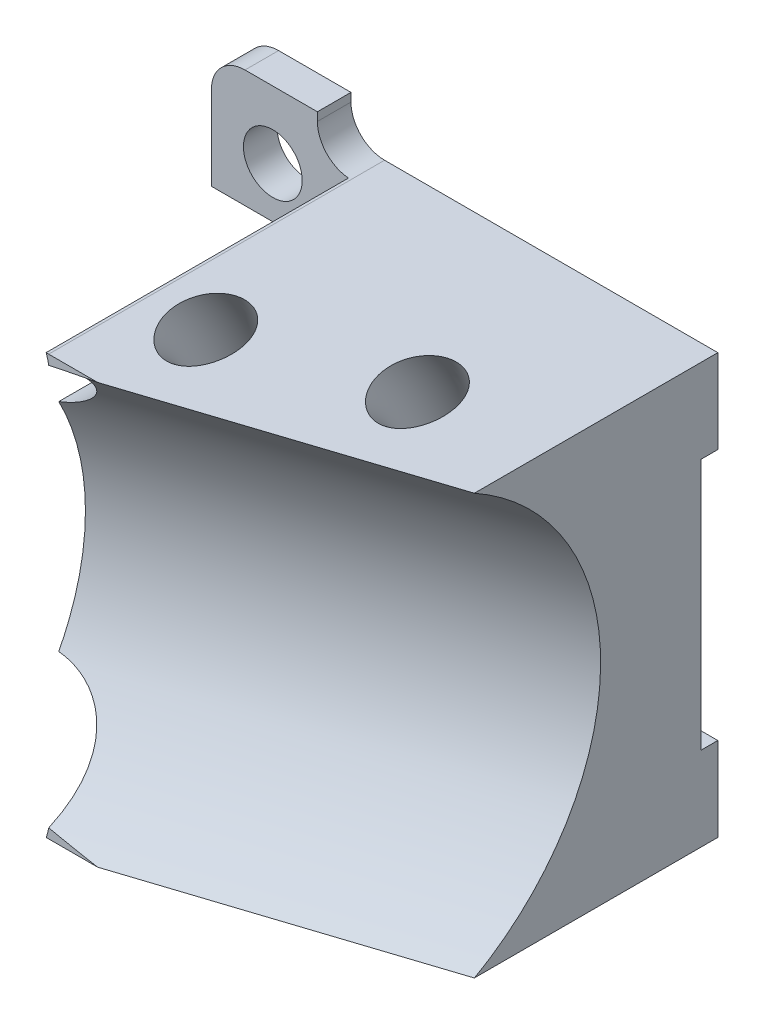
from build123d import *

# Parameters (mm, degrees)
SKETCH1_W               = 25
SKETCH1_H               = 25
BOSS_EXTRUDE1_DEPTH     = 20
SKETCH2_R               = 14.5
CUT_EXTRUDE1_DEPTH      = 36.825056471
SKETCH3_W               = 6.310364348
SKETCH3_H               = 30
BOSS_EXTRUDE2_DEPTH     = 2
SKETCH4_W               = 10
SKETCH4_H               = 16
CUT_EXTRUDE2_DEPTH      = 30.497198662
CUT_EXTRUDE3_DEPTH      = 29.179509025
CUT_EXTRUDE3_DEPTH_BACK = 29.179509025
SKETCH5_R               = 1.75
SKETCH7_R               = 4.75
CUT_EXTRUDE4_DEPTH      = 29.179509089
CUT_SWEEP1_PROFILE_R    = 2
LPATTERN1_COUNT         = 2
LPATTERN1_PITCH         = 10
FILLET1_START           = -1
FILLET1_DEPTH           = 21
FILLET1_2_DEPTH         = 2
FILLET1_START_2         = 1.80548
FILLET1_3_DEPTH         = 18.19452
SKETCH11_W              = 2
SKETCH11_H              = 15
CUT_EXTRUDE5_DEPTH      = 38.652546889


with BuildPart() as part:
    # Sketch1 → Boss-Extrude1 (new body)
    with BuildSketch(Plane.XY):
        Rectangle(SKETCH1_W, SKETCH1_H)
    extrude(amount=BOSS_EXTRUDE1_DEPTH)

    # Sketch2 → Cut-Extrude1 (cut, through all)
    with BuildSketch(Plane(origin=(11.306356215, 0, -3.673657827), x_dir=(0, 1, 0), z_dir=(0.9510565162951534, 0, -0.3090169943749482))):
        with Locations((0, 25)):
            Circle(SKETCH2_R)
    extrude(amount=-CUT_EXTRUDE1_DEPTH, mode=Mode.SUBTRACT)

    # Sketch3 → Boss-Extrude2 (add)
    with BuildSketch(Plane.XY):
        with Locations((-12.5, 0)):
            Rectangle(SKETCH3_W, SKETCH3_H)
    extrude(amount=BOSS_EXTRUDE2_DEPTH)

    # Sketch4 → Cut-Extrude2 (cut, through all)
    with BuildSketch(Plane.XY):
        with Locations((-15.655182174, 0)):
            Rectangle(SKETCH4_W, SKETCH4_H)
    extrude(amount=CUT_EXTRUDE2_DEPTH, mode=Mode.SUBTRACT)

    # Sketch5 → Cut-Extrude3 (cut, two sides: drawn at the far end of the back side and taken through both)
    with BuildSketch(Plane.XY.offset(2).offset(-CUT_EXTRUDE3_DEPTH_BACK)):
        with Locations((-12, 11)):
            Circle(SKETCH5_R)
        with Locations((-12, -11)):
            Circle(SKETCH5_R)
    extrude(amount=CUT_EXTRUDE3_DEPTH + CUT_EXTRUDE3_DEPTH_BACK, mode=Mode.SUBTRACT)

    # Sketch7 → Cut-Extrude4 (cut, through all)
    with BuildSketch(Plane.XY.offset(2)):
        with Locations((-12, 11)):
            Circle(SKETCH7_R)
        with Locations((-12, -11)):
            Circle(SKETCH7_R)
    extrude(amount=CUT_EXTRUDE4_DEPTH, mode=Mode.SUBTRACT)

    # Cut-Sweep1: sweep along a path in Sketch8
    with BuildLine(Plane(origin=(1.795791052, 0, -0.583487883), x_dir=(0, 1, 0), z_dir=(0.9510565162951534, 0, -0.3090169943749482))) as cut_sweep1_path:
        CenterArc((0, 25), 18, 0, 360)
    # Cut-Sweep1 profile (on start of the path) → Cut-Sweep1 (sweep, cut)
    with BuildSketch(Plane(origin=(9.521215911, 18, 23.192925024), x_dir=(0.9510565162951534, 0, -0.3090169943749482), z_dir=(0.3090169943749482, 0, 0.9510565162951534))):
        Circle(CUT_SWEEP1_PROFILE_R)
    cut_sweep1 = sweep(path=cut_sweep1_path.line, mode=Mode.SUBTRACT)

    # LPattern1: Cut-Sweep1 ×2
    with Locations(*[Vector(-0.9510565162951534, 0, 0.3090169943749481) * (i * LPATTERN1_PITCH) for i in range(1, LPATTERN1_COUNT)]):
        add(cut_sweep1, mode=Mode.SUBTRACT)

    # Fillet1: read off the stored shape, not the designer's step
    # Fillet1 outline → Fillet1 (cut)
    with BuildSketch(Plane.XY.offset(FILLET1_START)):
        with BuildLine():
            ThreePointArc((-15.655182174, 13), (-15.069395736, 14.414213562), (-13.655182174, 15))
            Line((-13.655182174, 15), (-15.655182174, 15))
            Line((-15.655182174, 15), (-15.655182174, 13))
        make_face()
        with BuildLine():
            Line((-15.655182174, -15), (-13.655182174, -15))
            ThreePointArc((-13.655182174, -15), (-15.069395736, -14.414213562), (-15.655182174, -13))
            Line((-15.655182174, -13), (-15.655182174, -15))
        make_face()
    extrude(amount=FILLET1_DEPTH, mode=Mode.SUBTRACT)

    # Fillet1 2 outline → Fillet1 2 (add)
    with BuildSketch(Plane.XY):
        with BuildLine():
            Line((-9.344817826, 14.5), (-9.344817826, 12.5))
            Line((-9.344817826, 12.5), (-7.344817826, 12.5))
            ThreePointArc((-7.344817826, 12.5), (-8.759031388, 13.085786438), (-9.344817826, 14.5))
        make_face()
        with BuildLine():
            Line((-9.344817826, -12.5), (-9.344817826, -14.5))
            ThreePointArc((-9.344817826, -14.5), (-8.759031388, -13.085786438), (-7.344817826, -12.5))
            Line((-7.344817826, -12.5), (-9.344817826, -12.5))
        make_face()
    extrude(amount=FILLET1_2_DEPTH)

    # Fillet1 3 outline → Fillet1 3 (add)
    with BuildSketch(Plane.XY.offset(FILLET1_START_2)):
        with BuildLine():
            ThreePointArc((-7.344817826, 12.5), (-7.419933265, 12.50141108), (-7.494942711, 12.505642329))
            ThreePointArc((-7.494942711, 12.505642329), (-7.494000925, 12.502821459), (-7.493060906, 12.5))
            Line((-7.493060906, 12.5), (-7.344817826, 12.5))
        make_face()
        with BuildLine():
            ThreePointArc((-7.493060906, -12.5), (-7.494000925, -12.502821459), (-7.494942711, -12.505642329))
            ThreePointArc((-7.494942711, -12.505642329), (-7.419933265, -12.50141108), (-7.344817826, -12.5))
            Line((-7.344817826, -12.5), (-7.493060906, -12.5))
        make_face()
    extrude(amount=FILLET1_3_DEPTH)

    # Sketch11 → Cut-Extrude5 (cut, through all)
    with BuildSketch(Plane(origin=(12.5, 0, 0), x_dir=(0, 0, -1), z_dir=(1, 0, 0))):
        Rectangle(SKETCH11_W, SKETCH11_H)
    extrude(amount=-CUT_EXTRUDE5_DEPTH, mode=Mode.SUBTRACT)


solid = part.part
